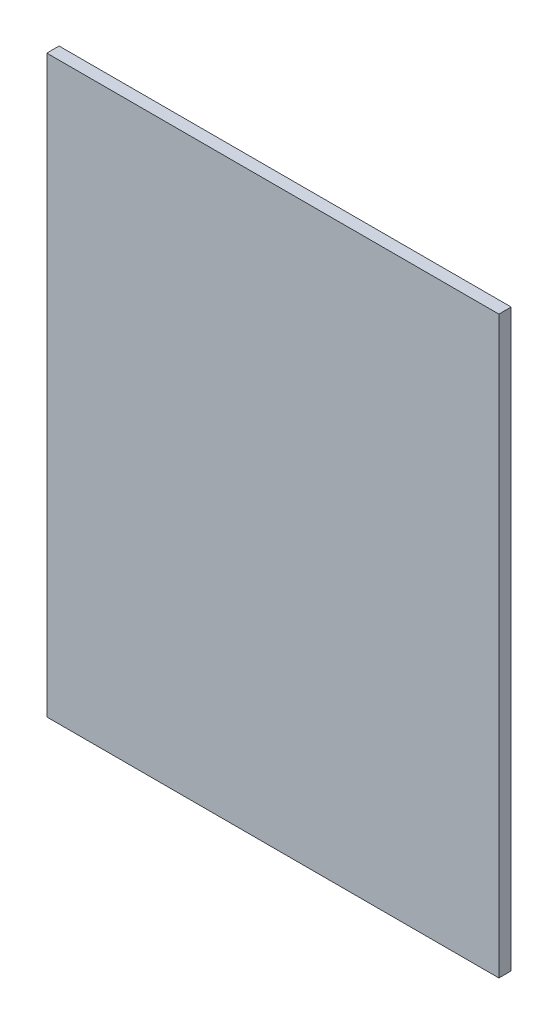
from build123d import *

# Parameters (mm, degrees)
CROQUIS1_W              = 36.8
CROQUIS1_H              = 46.8
SALIENTE_EXTRUIR1_DEPTH = 1


with BuildPart() as part:
    # Croquis1 → Saliente-Extruir1 (new body)
    with BuildSketch(Plane.XY):
        Rectangle(CROQUIS1_W, CROQUIS1_H)
    extrude(amount=SALIENTE_EXTRUIR1_DEPTH)


solid = part.part
